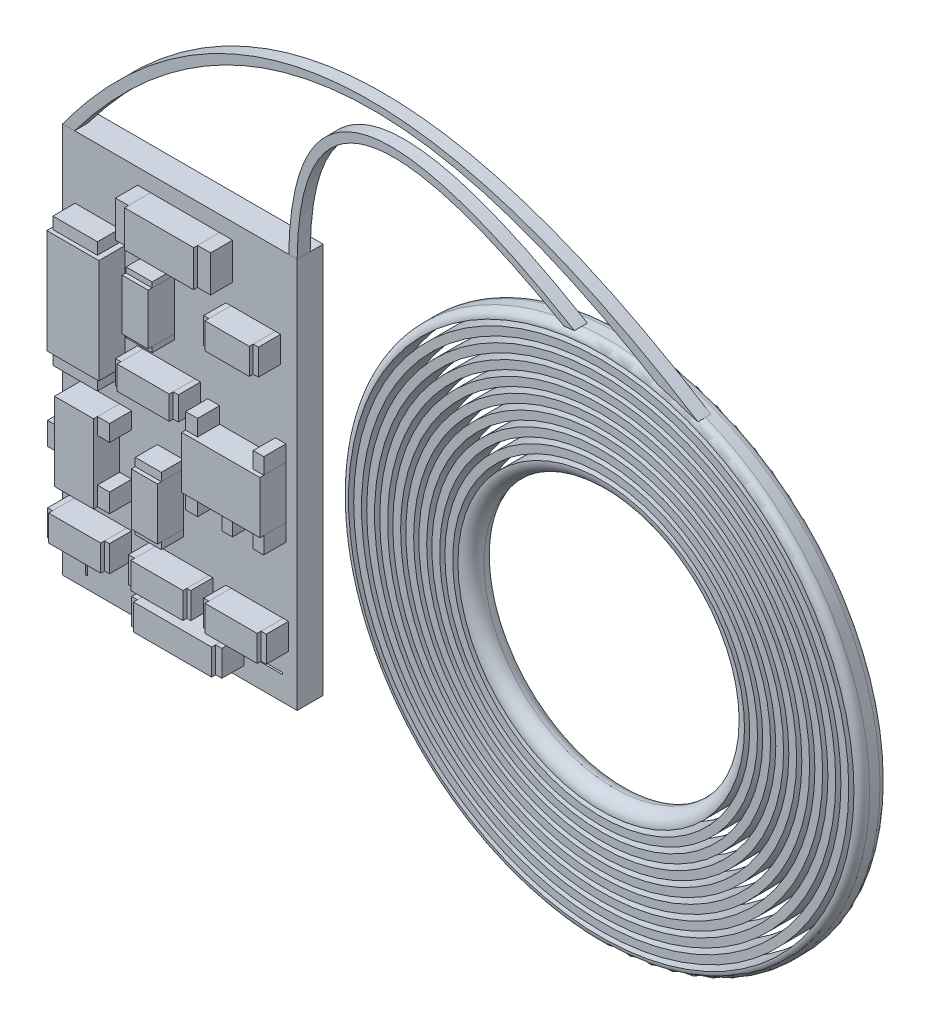
from build123d import *

# Parameters (mm, degrees)
SKETCH_1_R          = 10
SKETCH_1_R_2        = 5
EXTRUDE_1_DEPTH     = 1
SKETCH_2_R          = 5.7
SKETCH_2_R_2        = 5.5
CUT_EXTRUDE_1_DEPTH = 15.177446879
SKETCH_4_R          = 9.7
SKETCH_4_R_2        = 9.5
SKETCH_4_R_3        = 9.2
SKETCH_4_R_4        = 9
SKETCH_4_R_5        = 8.7
SKETCH_4_R_6        = 8.5
SKETCH_4_R_7        = 8.2
SKETCH_4_R_8        = 8
SKETCH_4_R_9        = 7.7
SKETCH_4_R_10       = 7.5
SKETCH_4_R_11       = 7.2
SKETCH_4_R_12       = 7
SKETCH_4_R_13       = 6.7
SKETCH_4_R_14       = 6.5
SKETCH_4_R_15       = 6.2
SKETCH_4_R_16       = 6
CUT_EXTRUDE_2_DEPTH = 15.177446879
FILLET_1_R          = 0.5
FILLET_2_R          = 0.3
EXTRUDE_2_DEPTH     = 1
EXTRUDE_3_DEPTH     = 0.5
EXTRUDE_3_2_DEPTH   = 0.5
SKETCH_7_W          = 0.971814675
SKETCH_7_H          = 0.0699822
CUT_EXTRUDE_3_DEPTH = 0.1
SKETCH_8_W          = 2.649559742
SKETCH_8_H          = 1.399767411
SKETCH_8_W_2        = 1.699717571
SKETCH_8_H_2        = 1
SKETCH_8_W_3        = 3
SKETCH_8_H_3        = 2
SKETCH_8_W_4        = 1
SKETCH_8_H_4        = 1.952426821
SKETCH_8_W_5        = 2
SKETCH_8_H_5        = 4
SKETCH_8_H_6        = 0.906419928
SKETCH_8_W_6        = 1.5
SKETCH_8_H_7        = 3
EXTRUDE_4_DEPTH     = 1
SKETCH_9_W          = 0.5
SKETCH_9_H          = 1.399767411
EXTRUDE_5_DEPTH     = 0.85
EXTRUDE_5_2_DEPTH   = 0.85
SKETCH_9_W_2        = 0.2
SKETCH_9_H_2        = 1
EXTRUDE_5_3_DEPTH   = 0.85
EXTRUDE_5_4_DEPTH   = 0.85
SKETCH_9_W_3        = 1.709249397
SKETCH_9_H_3        = 0.449234626
EXTRUDE_5_5_DEPTH   = 0.85
SKETCH_9_H_4        = 0.516490132
EXTRUDE_5_6_DEPTH   = 0.85
SKETCH_9_W_4        = 0.457181797
SKETCH_9_H_5        = 0.618730739
EXTRUDE_5_7_DEPTH   = 0.85
SKETCH_9_W_5        = 0.405911041
EXTRUDE_5_8_DEPTH   = 0.85
SKETCH_9_H_6        = 0.650348376
EXTRUDE_5_9_DEPTH   = 0.85
SKETCH_9_W_6        = 0.410440091
EXTRUDE_5_10_DEPTH  = 0.85
EXTRUDE_5_11_DEPTH  = 0.85
SKETCH_9_W_7        = 1
SKETCH_9_H_7        = 0.309482811
EXTRUDE_5_12_DEPTH  = 0.85
SKETCH_9_H_8        = 0.262278275
EXTRUDE_5_13_DEPTH  = 0.85
SKETCH_9_W_8        = 0.463710487
SKETCH_9_H_9        = 0.630767117
EXTRUDE_5_14_DEPTH  = 0.85
SKETCH_9_W_9        = 0.418498794
SKETCH_9_H_10       = 0.864572242
EXTRUDE_5_15_DEPTH  = 0.85
SKETCH_9_H_11       = 0.723121774
EXTRUDE_5_16_DEPTH  = 0.85
SKETCH_9_W_10       = 0.193744487
EXTRUDE_5_17_DEPTH  = 0.85
SKETCH_9_W_11       = 0.188464794
EXTRUDE_5_18_DEPTH  = 0.85
SKETCH_9_W_12       = 0.239542541
SKETCH_9_H_12       = 0.994885187
EXTRUDE_5_19_DEPTH  = 0.85
SKETCH_9_W_13       = 0.221587638
EXTRUDE_5_20_DEPTH  = 0.85
SKETCH_9_H_13       = 0.2
EXTRUDE_5_21_DEPTH  = 0.85
EXTRUDE_5_22_DEPTH  = 0.85
SKETCH_9_W_14       = 0.212310039
SKETCH_9_H_14       = 0.906419928
EXTRUDE_5_23_DEPTH  = 0.85
EXTRUDE_5_24_DEPTH  = 0.85
SKETCH_9_W_15       = 0.239088225
EXTRUDE_5_25_DEPTH  = 0.85
SKETCH_9_W_16       = 0.150481426
EXTRUDE_5_26_DEPTH  = 0.85
EXTRUDE_5_27_DEPTH  = 0.85
SKETCH_9_W_17       = 0.201174942
EXTRUDE_5_28_DEPTH  = 0.85


# Some blends are built 0.0001 mm under size
with BuildPart() as part:
    # 草图1 → 凸台-拉伸1 (new body)
    with BuildSketch(Plane.XY):
        Circle(SKETCH_1_R)
        Circle(SKETCH_1_R_2, mode=Mode.SUBTRACT)
    extrude(amount=EXTRUDE_1_DEPTH)

    # 草图2 → 切除-拉伸1 (cut, through all)
    with BuildSketch(Plane.XY.offset(1)):
        Circle(SKETCH_2_R)
        Circle(SKETCH_2_R_2, mode=Mode.SUBTRACT)
    extrude(amount=-CUT_EXTRUDE_1_DEPTH, mode=Mode.SUBTRACT)


with BuildPart() as cut_extrude_1_piece_1:
    # of the separate pieces the step leaves, piece 1, a body of its own (cut_extrude_1_pieces)
    add(part.part.solids().sort_by_distance((10, 0, 0))[0])

    # 草图4 → 切除-拉伸2 (cut, through all)
    # profile 1 of 8: a face of its own
    with BuildSketch(Plane.XY.offset(1)):
        Circle(SKETCH_4_R)
        Circle(SKETCH_4_R_2, mode=Mode.SUBTRACT)
    # profile 2 of 8: a face of its own
    with BuildSketch(Plane.XY.offset(1)):
        Circle(SKETCH_4_R_3)
        Circle(SKETCH_4_R_4, mode=Mode.SUBTRACT)
    # profile 3 of 8: a face of its own
    with BuildSketch(Plane.XY.offset(1)):
        Circle(SKETCH_4_R_5)
        Circle(SKETCH_4_R_6, mode=Mode.SUBTRACT)
    # profile 4 of 8: a face of its own
    with BuildSketch(Plane.XY.offset(1)):
        Circle(SKETCH_4_R_7)
        Circle(SKETCH_4_R_8, mode=Mode.SUBTRACT)
    # profile 5 of 8: a face of its own
    with BuildSketch(Plane.XY.offset(1)):
        Circle(SKETCH_4_R_9)
        Circle(SKETCH_4_R_10, mode=Mode.SUBTRACT)
    # profile 6 of 8: a face of its own
    with BuildSketch(Plane.XY.offset(1)):
        Circle(SKETCH_4_R_11)
        Circle(SKETCH_4_R_12, mode=Mode.SUBTRACT)
    # profile 7 of 8: a face of its own
    with BuildSketch(Plane.XY.offset(1)):
        Circle(SKETCH_4_R_13)
        Circle(SKETCH_4_R_14, mode=Mode.SUBTRACT)
    # profile 8 of 8: a face of its own
    with BuildSketch(Plane.XY.offset(1)):
        Circle(SKETCH_4_R_15)
        Circle(SKETCH_4_R_16, mode=Mode.SUBTRACT)
    extrude(amount=-CUT_EXTRUDE_2_DEPTH, mode=Mode.SUBTRACT)


with BuildPart() as cut_extrude_1_piece_2:
    # of the separate pieces the step leaves, piece 2, a body of its own (cut_extrude_1_pieces)
    add(part.part.solids().sort_by_distance((5.5, 0, 0))[0])

    # 圆角1
    # the kernel refuses this fillet: 0.5 mm, written as the material it takes off along each edge
    with BuildSketch(Plane(origin=(0, 0, 0), x_dir=(1, 0, 0), z_dir=(0, -1, 0))) as fillet_1_piece_1:
        with BuildLine():
            CenterArc((5 + FILLET_1_R, FILLET_1_R), FILLET_1_R, 180, 90)
            Line((5, FILLET_1_R), (5, 0))
            Line((5, 0), (5 + FILLET_1_R, 0))
        make_face()
    revolve(axis=Axis((0, 0, 0), (0, 0, 1)), mode=Mode.SUBTRACT)
    with BuildSketch(Plane(origin=(0, 0, 1), x_dir=(1, 0, 0), z_dir=(0, -1, 0))) as fillet_1_piece_2:
        with BuildLine():
            CenterArc((5 + FILLET_1_R, -FILLET_1_R), FILLET_1_R, 90, 90)
            Line((5 + FILLET_1_R, 0), (5, 0))
            Line((5, 0), (5, -FILLET_1_R))
        make_face()
    revolve(axis=Axis((0, 0, 1), (0, 0, 1)), mode=Mode.SUBTRACT)


with BuildPart() as cut_extrude_2_piece_1:
    # of the separate pieces the step leaves, piece 1, a body of its own (cut_extrude_2_pieces)
    add(cut_extrude_1_piece_1.part.solids().sort_by_distance((10, 0, 0))[0])

    # 圆角2
    fillet_2_edges = [cut_extrude_2_piece_1.edges().sort_by_distance(p)[0] for p in [
        (-10, 0, 0),
        (-10, 0, 1),
    ]]
    fillet(fillet_2_edges, radius=FILLET_2_R - 0.0001)  # a hair under: the kernel refuses the full size


with BuildPart() as cut_extrude_2_piece_2:
    # of the separate pieces the step leaves, piece 2, a body of its own (cut_extrude_2_pieces)
    add(cut_extrude_1_piece_1.part.solids().sort_by_distance((9.5, 0, 0))[0])


with BuildPart() as cut_extrude_2_piece_3:
    # of the separate pieces the step leaves, piece 3, a body of its own (cut_extrude_2_pieces)
    add(cut_extrude_1_piece_1.part.solids().sort_by_distance((9, 0, 0))[0])


with BuildPart() as cut_extrude_2_piece_4:
    # of the separate pieces the step leaves, piece 4, a body of its own (cut_extrude_2_pieces)
    add(cut_extrude_1_piece_1.part.solids().sort_by_distance((8.5, 0, 0))[0])


with BuildPart() as cut_extrude_2_piece_5:
    # of the separate pieces the step leaves, piece 5, a body of its own (cut_extrude_2_pieces)
    add(cut_extrude_1_piece_1.part.solids().sort_by_distance((8, 0, 0))[0])


with BuildPart() as cut_extrude_2_piece_6:
    # of the separate pieces the step leaves, piece 6, a body of its own (cut_extrude_2_pieces)
    add(cut_extrude_1_piece_1.part.solids().sort_by_distance((7.5, 0, 0))[0])


with BuildPart() as cut_extrude_2_piece_7:
    # of the separate pieces the step leaves, piece 7, a body of its own (cut_extrude_2_pieces)
    add(cut_extrude_1_piece_1.part.solids().sort_by_distance((7, 0, 0))[0])


with BuildPart() as cut_extrude_2_piece_8:
    # of the separate pieces the step leaves, piece 8, a body of its own (cut_extrude_2_pieces)
    add(cut_extrude_1_piece_1.part.solids().sort_by_distance((6.5, 0, 0))[0])


with BuildPart() as cut_extrude_2_piece_9:
    # of the separate pieces the step leaves, piece 9, a body of its own (cut_extrude_2_pieces)
    add(cut_extrude_1_piece_1.part.solids().sort_by_distance((6, 0, 0))[0])


with BuildPart() as body_11:
    # 草图5 → 凸台-拉伸2 (new body)
    with BuildSketch(Plane.XY):
        Polygon((-11.67, 0), (-11.67, 7), (-20.67, 7), (-20.67, -8), (-11.67, -8), align=None)
    extrude(amount=EXTRUDE_2_DEPTH)

    # 草图7 → 切除-拉伸3 (cut)
    with BuildSketch(Plane.XY.offset(1)):
        with Locations((-12.715613037, -7.050415369)):
            Rectangle(SKETCH_7_W, SKETCH_7_H)
        Polygon((-19.792569199, -7.088532822), (-19.792569199, -7.551233004), (-19.724751397, -7.551233004), (-19.724751397, -7.088532822), (-19.272632716, -7.088532822), (-19.272632716, -7.01879111), (-19.724751397, -7.01879111), (-19.724751397, -6.556090929), (-19.792569199, -6.556090929), (-19.792569199, -7.01879111), (-20.244447391, -7.01879111), (-20.244447391, -7.088532822), align=None)
    extrude(amount=-CUT_EXTRUDE_3_DEPTH, mode=Mode.SUBTRACT)

    # 草图8 → 凸台-拉伸4 (add)
    with BuildSketch(Plane.XY.offset(1)):
        with Locations((-15.967743784, 5.698738692)):
            Rectangle(SKETCH_8_W, SKETCH_8_H)
        with Locations((-13.355915537, 3.685426523)):
            Rectangle(SKETCH_8_W_2, SKETCH_8_H_2)
        with Locations((-13.60014571, -0.97069448)):
            Rectangle(SKETCH_8_W_3, SKETCH_8_H_3)
        with Locations((-16.884912988, 3.136810223)):
            Rectangle(SKETCH_8_W_4, SKETCH_8_H_4)
        with Locations((-19.279765051, 2.149660741)):
            Rectangle(SKETCH_8_W_5, SKETCH_8_H_5)
        with Locations((-16.580213616, 0.610320381)):
            Rectangle(SKETCH_8_W_5, SKETCH_8_H_6)
        with Locations((-16.533635357, -3.150720523)):
            Rectangle(SKETCH_8_W_4, SKETCH_8_H_3)
        with Locations((-19.2333883, -2.710470595)):
            Rectangle(SKETCH_8_W_6, SKETCH_8_H_7)
        with Locations((-15.451391905, -7.031855731)):
            Rectangle(SKETCH_8_W_3, SKETCH_8_H_2)
        with Locations((-19.208142607, -5.70364011)):
            Rectangle(SKETCH_8_W_5, SKETCH_8_H_2)
        with Locations((-16.05343543, -5.70364011)):
            Rectangle(SKETCH_8_W_5, SKETCH_8_H_2)
        with Locations((-13.205774322, -5.70364011)):
            Rectangle(SKETCH_8_W_5, SKETCH_8_H_2)
    extrude(amount=EXTRUDE_4_DEPTH)


with BuildPart() as body_12:
    # 草图6 → 凸台-拉伸3 (new body)
    with BuildSketch(Plane.XY.offset(1)):
        with BuildLine():
            Line((-1.42647562, 9.897735464), (-1.029548471, 9.946860306))
            add(Edge.make_bspline(
                [(-11.992808049, 7), (-11.838395572, 16.344239422), (-1.029548471, 9.946860306)],
                knots=[0, 0, 0, 1, 1, 1], degree=2))
            Line((-11.992808049, 7), (-11.67, 7))
            add(Edge.make_bspline(
                [(-11.67, 7), (-11.592122737, 15.747449951), (-1.42647562, 9.897735464)],
                knots=[0, 0, 0, 1, 1, 1], degree=2))
        make_face()
    extrude(amount=-EXTRUDE_3_DEPTH)


with BuildPart() as body_13:
    # 草图6 → Extrude 3 2 (new body)
    with BuildSketch(Plane.XY.offset(1)):
        with BuildLine():
            Line((2.143375863, 9.767596424), (3.711695939, 9.285650934))
            add(Edge.make_bspline(
                [(-20.67, 7), (-11.869085609, 19.096620372), (3.711695939, 9.285650934)],
                knots=[0, 0, 0, 1, 1, 1], degree=2))
            Line((-20.67, 7), (-20.211121712, 7))
            add(Edge.make_bspline(
                [(-20.211121712, 7), (-11.705480258, 18.255093394), (2.143375863, 9.767596424)],
                knots=[0, 0, 0, 1, 1, 1], degree=2))
        make_face()
    extrude(amount=-EXTRUDE_3_2_DEPTH)


with BuildPart() as body_14:
    # 草图9 → 凸台-拉伸5 (new body)
    with BuildSketch(Plane.XY.offset(1)):
        with Locations((-17.542523655, 5.698738692)):
            Rectangle(SKETCH_9_W, SKETCH_9_H)
    extrude(amount=EXTRUDE_5_DEPTH)


with BuildPart() as body_15:
    # 草图9 → Extrude 5 2 (new body)
    with BuildSketch(Plane.XY.offset(1)):
        with Locations((-14.392963913, 5.698738692)):
            Rectangle(SKETCH_9_W, SKETCH_9_H)
    extrude(amount=EXTRUDE_5_2_DEPTH)


with BuildPart() as body_16:
    # 草图9 → Extrude 5 3 (new body)
    with BuildSketch(Plane.XY.offset(1)):
        with Locations((-14.305774322, 3.685426523)):
            Rectangle(SKETCH_9_W_2, SKETCH_9_H_2)
    extrude(amount=EXTRUDE_5_3_DEPTH)


with BuildPart() as body_17:
    # 草图9 → Extrude 5 4 (new body)
    with BuildSketch(Plane.XY.offset(1)):
        with Locations((-12.406056751, 3.685426523)):
            Rectangle(SKETCH_9_W_2, SKETCH_9_H_2)
    extrude(amount=EXTRUDE_5_4_DEPTH)


with BuildPart() as body_18:
    # 草图9 → Extrude 5 5 (new body)
    with BuildSketch(Plane.XY.offset(1)):
        with Locations((-19.338012999, 4.374278054)):
            Rectangle(SKETCH_9_W_3, SKETCH_9_H_3)
    extrude(amount=EXTRUDE_5_5_DEPTH)


with BuildPart() as body_19:
    # 草图9 → Extrude 5 6 (new body)
    with BuildSketch(Plane.XY.offset(1)):
        with Locations((-19.338012999, -0.108584325)):
            Rectangle(SKETCH_9_W_3, SKETCH_9_H_4)
    extrude(amount=EXTRUDE_5_6_DEPTH)


with BuildPart() as body_20:
    # 草图9 → Extrude 5 7 (new body)
    with BuildSketch(Plane.XY.offset(1)):
        with Locations((-14.871554812, 0.33867089)):
            Rectangle(SKETCH_9_W_4, SKETCH_9_H_5)
    extrude(amount=EXTRUDE_5_7_DEPTH)


with BuildPart() as body_21:
    # 草图9 → Extrude 5 8 (new body)
    with BuildSketch(Plane.XY.offset(1)):
        with Locations((-12.303101231, 0.33867089)):
            Rectangle(SKETCH_9_W_5, SKETCH_9_H_5)
    extrude(amount=EXTRUDE_5_8_DEPTH)


with BuildPart() as body_22:
    # 草图9 → Extrude 5 9 (new body)
    with BuildSketch(Plane.XY.offset(1)):
        with Locations((-12.303101231, -2.295868668)):
            Rectangle(SKETCH_9_W_5, SKETCH_9_H_6)
    extrude(amount=EXTRUDE_5_9_DEPTH)


with BuildPart() as body_23:
    # 草图9 → Extrude 5 10 (new body)
    with BuildSketch(Plane.XY.offset(1)):
        with Locations((-13.506629318, -2.295868668)):
            Rectangle(SKETCH_9_W_6, SKETCH_9_H_6)
    extrude(amount=EXTRUDE_5_10_DEPTH)


with BuildPart() as body_24:
    # 草图9 → Extrude 5 11 (new body)
    with BuildSketch(Plane.XY.offset(1)):
        with Locations((-14.871554812, -2.295868668)):
            Rectangle(SKETCH_9_W_4, SKETCH_9_H_6)
    extrude(amount=EXTRUDE_5_11_DEPTH)


with BuildPart() as body_25:
    # 草图9 → Extrude 5 12 (new body)
    with BuildSketch(Plane.XY.offset(1)):
        with Locations((-16.533635357, -1.995979118)):
            Rectangle(SKETCH_9_W_7, SKETCH_9_H_7)
    extrude(amount=EXTRUDE_5_12_DEPTH)


with BuildPart() as body_26:
    # 草图9 → Extrude 5 13 (new body)
    with BuildSketch(Plane.XY.offset(1)):
        with Locations((-16.533635357, -4.281859661)):
            Rectangle(SKETCH_9_W_7, SKETCH_9_H_8)
    extrude(amount=EXTRUDE_5_13_DEPTH)


with BuildPart() as body_27:
    # 草图9 → Extrude 5 14 (new body)
    with BuildSketch(Plane.XY.offset(1)):
        with Locations((-18.251533057, -1.525854154)):
            Rectangle(SKETCH_9_W_8, SKETCH_9_H_9)
    extrude(amount=EXTRUDE_5_14_DEPTH)


with BuildPart() as body_28:
    # 草图9 → Extrude 5 15 (new body)
    with BuildSketch(Plane.XY.offset(1)):
        with Locations((-20.192637697, -2.728154789)):
            Rectangle(SKETCH_9_W_9, SKETCH_9_H_10)
    extrude(amount=EXTRUDE_5_15_DEPTH)


with BuildPart() as body_29:
    # 草图9 → Extrude 5 16 (new body)
    with BuildSketch(Plane.XY.offset(1)):
        with Locations((-18.251533057, -3.848909708)):
            Rectangle(SKETCH_9_W_8, SKETCH_9_H_11)
    extrude(amount=EXTRUDE_5_16_DEPTH)


with BuildPart() as body_30:
    # 草图9 → Extrude 5 17 (new body)
    with BuildSketch(Plane.XY.offset(1)):
        with Locations((-20.305014851, -5.70364011)):
            Rectangle(SKETCH_9_W_10, SKETCH_9_H_2)
    extrude(amount=EXTRUDE_5_17_DEPTH)


with BuildPart() as body_31:
    # 草图9 → Extrude 5 18 (new body)
    with BuildSketch(Plane.XY.offset(1)):
        with Locations((-18.11391021, -5.70364011)):
            Rectangle(SKETCH_9_W_11, SKETCH_9_H_2)
    extrude(amount=EXTRUDE_5_18_DEPTH)


with BuildPart() as body_32:
    # 草图9 → Extrude 5 19 (new body)
    with BuildSketch(Plane.XY.offset(1)):
        with Locations((-13.831620635, -7.029298325)):
            Rectangle(SKETCH_9_W_12, SKETCH_9_H_12)
    extrude(amount=EXTRUDE_5_19_DEPTH)


with BuildPart() as body_33:
    # 草图9 → Extrude 5 20 (new body)
    with BuildSketch(Plane.XY.offset(1)):
        with Locations((-17.062185724, -7.029298325)):
            Rectangle(SKETCH_9_W_13, SKETCH_9_H_12)
    extrude(amount=EXTRUDE_5_20_DEPTH)


with BuildPart() as body_34:
    # 草图9 → Extrude 5 21 (new body)
    with BuildSketch(Plane.XY.offset(1)):
        with Locations((-16.884912988, 4.213023633)):
            Rectangle(SKETCH_9_W_7, SKETCH_9_H_13)
    extrude(amount=EXTRUDE_5_21_DEPTH)


with BuildPart() as body_35:
    # 草图9 → Extrude 5 22 (new body)
    with BuildSketch(Plane.XY.offset(1)):
        with Locations((-16.884912988, 2.060596812)):
            Rectangle(SKETCH_9_W_7, SKETCH_9_H_13)
    extrude(amount=EXTRUDE_5_22_DEPTH)


with BuildPart() as body_36:
    # 草图9 → Extrude 5 23 (new body)
    with BuildSketch(Plane.XY.offset(1)):
        with Locations((-17.686368636, 0.610320381)):
            Rectangle(SKETCH_9_W_14, SKETCH_9_H_14)
    extrude(amount=EXTRUDE_5_23_DEPTH)


with BuildPart() as body_37:
    # 草图9 → Extrude 5 24 (new body)
    with BuildSketch(Plane.XY.offset(1)):
        with Locations((-15.480213616, 0.610320381)):
            Rectangle(SKETCH_9_W_2, SKETCH_9_H_14)
    extrude(amount=EXTRUDE_5_24_DEPTH)


with BuildPart() as body_38:
    # 草图9 → Extrude 5 25 (new body)
    with BuildSketch(Plane.XY.offset(1)):
        with Locations((-17.172979543, -5.70364011)):
            Rectangle(SKETCH_9_W_15, SKETCH_9_H_2)
    extrude(amount=EXTRUDE_5_25_DEPTH)


with BuildPart() as body_39:
    # 草图9 → Extrude 5 26 (new body)
    with BuildSketch(Plane.XY.offset(1)):
        with Locations((-14.978194717, -5.70364011)):
            Rectangle(SKETCH_9_W_16, SKETCH_9_H_2)
    extrude(amount=EXTRUDE_5_26_DEPTH)


with BuildPart() as body_40:
    # 草图9 → Extrude 5 27 (new body)
    with BuildSketch(Plane.XY.offset(1)):
        with Locations((-14.305774322, -5.70364011)):
            Rectangle(SKETCH_9_W_2, SKETCH_9_H_2)
    extrude(amount=EXTRUDE_5_27_DEPTH)


with BuildPart() as body_41:
    # 草图9 → Extrude 5 28 (new body)
    with BuildSketch(Plane.XY.offset(1)):
        with Locations((-12.105186851, -5.70364011)):
            Rectangle(SKETCH_9_W_17, SKETCH_9_H_2)
    extrude(amount=EXTRUDE_5_28_DEPTH)


solid = Compound([cut_extrude_1_piece_2.part, cut_extrude_2_piece_1.part, cut_extrude_2_piece_2.part, cut_extrude_2_piece_3.part, cut_extrude_2_piece_4.part, cut_extrude_2_piece_5.part, cut_extrude_2_piece_6.part, cut_extrude_2_piece_7.part, cut_extrude_2_piece_8.part, cut_extrude_2_piece_9.part, body_11.part, body_12.part, body_13.part, body_14.part, body_15.part, body_16.part, body_17.part, body_18.part, body_19.part, body_20.part, body_21.part, body_22.part, body_23.part, body_24.part, body_25.part, body_26.part, body_27.part, body_28.part, body_29.part, body_30.part, body_31.part, body_32.part, body_33.part, body_34.part, body_35.part, body_36.part, body_37.part, body_38.part, body_39.part, body_40.part, body_41.part])
